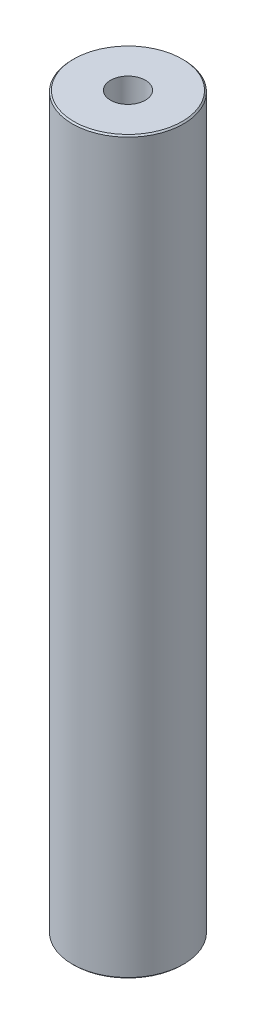
from build123d import *

# Parameters (mm, degrees)
SKETCH1_R           = 12.5
BOSS_EXTRUDE1_DEPTH = 164.352950885
SKETCH2_R           = 3.911458497
CUT_EXTRUDE1_DEPTH  = 166.300914894
CHAMFER1_SIZE       = 0.312789996


with BuildPart() as part:
    # Sketch1 → Boss-Extrude1 (new body)
    with BuildSketch(Plane(origin=(0, 0, 0), x_dir=(1, 0, 0), z_dir=(0, 1, 0))):
        Circle(SKETCH1_R)
    extrude(amount=BOSS_EXTRUDE1_DEPTH)

    # Sketch2 → Cut-Extrude1 (cut, through all)
    with BuildSketch(Plane(origin=(0, 0, 0), x_dir=(1, 0, 0), z_dir=(0, 1, 0))):
        Circle(SKETCH2_R)
    extrude(amount=CUT_EXTRUDE1_DEPTH, mode=Mode.SUBTRACT)

    # Chamfer1
    chamfer1_edges = [part.edges().sort_by_distance(p)[0] for p in [
        (-12.5, 164.352950885, 0),
        (-12.5, 0, 0),
    ]]
    chamfer(chamfer1_edges, length=CHAMFER1_SIZE)


solid = part.part
